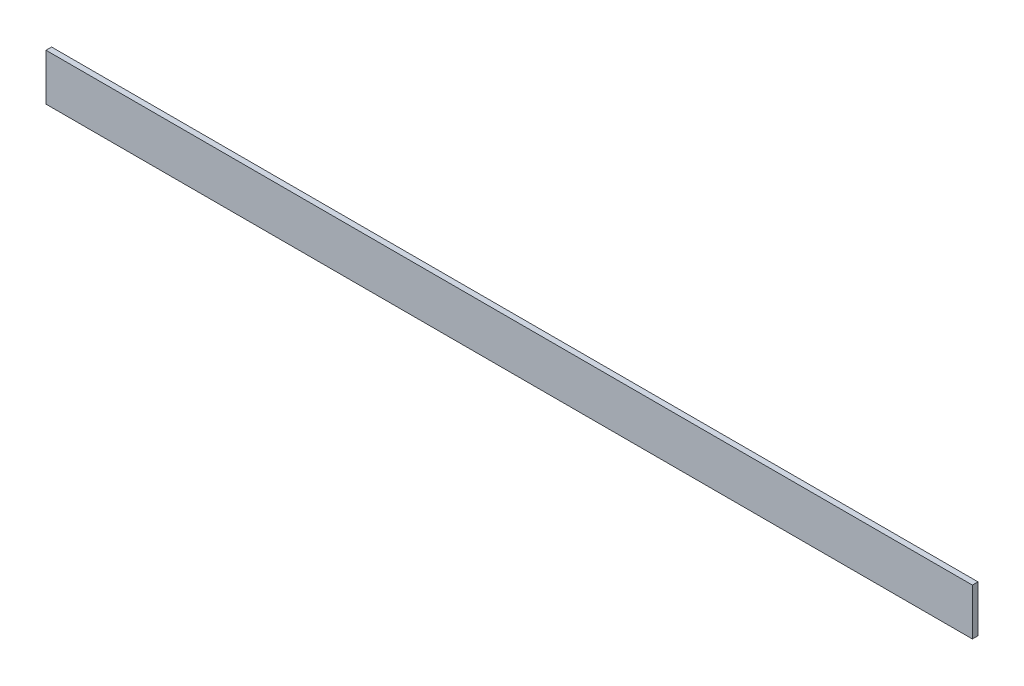
from build123d import *

# Parameters (mm, degrees)
EXTRUDE_1_DEPTH     = 496
SKETCH_2_W          = 25
SKETCH_2_H          = 22
CUT_EXTRUDE_1_DEPTH = 498.258484091


with BuildPart() as part:
    # Эскиз1 → Вытянуть-Тонкостенный1 (new body)
    with BuildSketch(Plane(origin=(0, 0, 0), x_dir=(0, 0, -1), z_dir=(1, 0, 0))):
        Polygon((0, 25), (0, 0), (25, 0), (25, 3), (3, 3), (3, 25), align=None)
    extrude(amount=EXTRUDE_1_DEPTH)

    # Эскиз2 → Вырез-Вытянуть1 (cut, through all)
    with BuildSketch(Plane.XZ):
        with Locations((483.5, -14)):
            Rectangle(SKETCH_2_W, SKETCH_2_H)
        with Locations((12.5, -14)):
            Rectangle(SKETCH_2_W, SKETCH_2_H)
    extrude(amount=-CUT_EXTRUDE_1_DEPTH, mode=Mode.SUBTRACT)


solid = part.part
